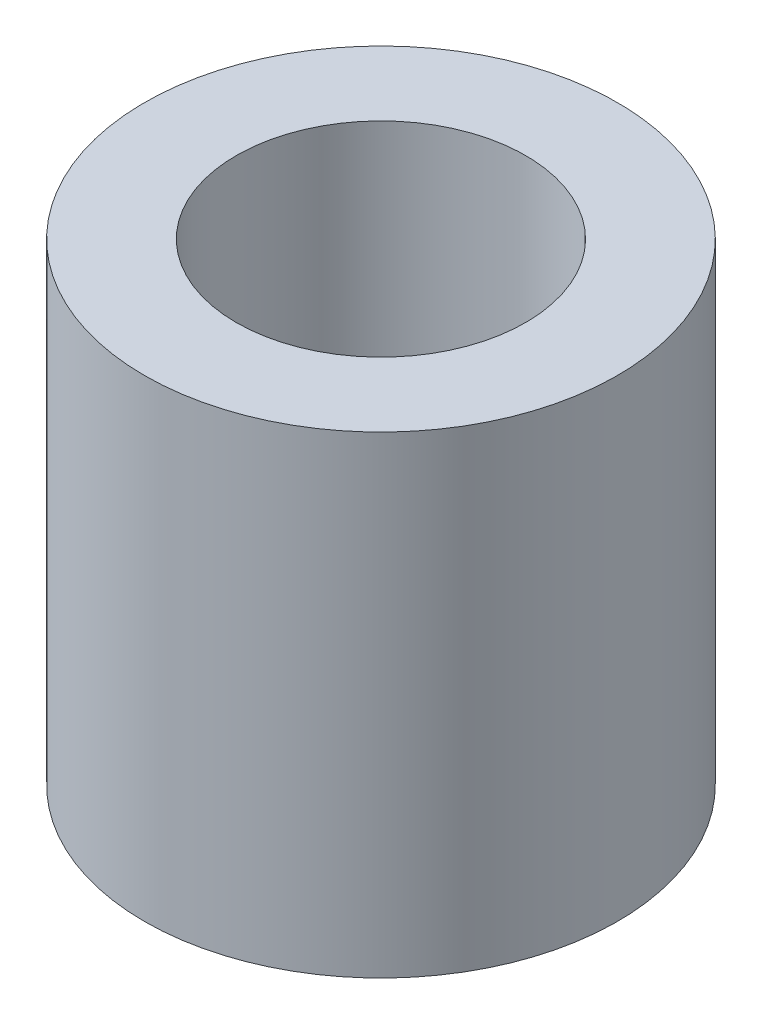
from build123d import *

# Parameters (mm, degrees)
CROQUIS1_R              = 2.5
CROQUIS1_R_2            = 1.53
SALIENTE_EXTRUIR1_DEPTH = 5


with BuildPart() as part:
    # Croquis1 → Saliente-Extruir1 (new body)
    with BuildSketch(Plane(origin=(0, 0, 0), x_dir=(1, 0, 0), z_dir=(0, 1, 0))):
        Circle(CROQUIS1_R)
        Circle(CROQUIS1_R_2, mode=Mode.SUBTRACT)
    extrude(amount=SALIENTE_EXTRUIR1_DEPTH)


solid = part.part
